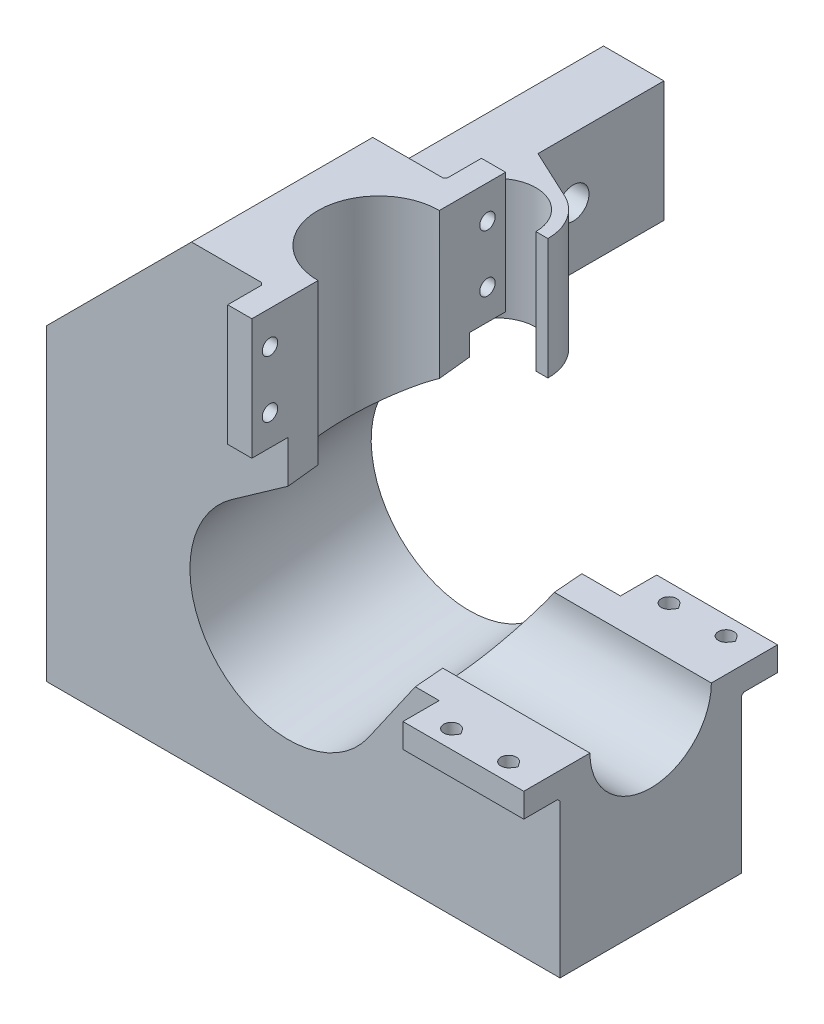
from build123d import *

# Parameters (mm, degrees)
BOSS_EXTRUDE1_DEPTH                       = 12.7
BOSS_EXTRUDE1_DEPTH_BACK                  = 12.7
CUT_EXTRUDE1_DEPTH                        = 83.589067678
CUT_EXTRUDE1_DEPTH_BACK                   = 83.589067678
SKETCH5_R                                 = 3.302
BOSS_EXTRUDE_START                        = -12.7
SKETCH10_W                                = 12.7
SKETCH10_H                                = 38.1
BOSS_EXTRUDE_ARM_FB_WIDTH_DEPTH           = 44.45
BOSS_EXTRUDE_ARM_CHASSIS_FB_DEPTH         = 95.25
SKETCH15_W                                = 55.88
SKETCH15_H                                = 38.1
BOSS_EXTRUDE_ARM_CHASSIS_LR_DEPTH         = 50.8
SKETCH16_R                                = 12.7635
CUT_EXTRUDE_CHASSIS_FB_DEPTH              = 128.199614864
SKETCH17_R                                = 12.7635
SKETCH17_W                                = 12.7635
SKETCH17_H                                = 38.1
CUT_EXTRUDE_CHASSIS_LR_DEPTH              = 128.199614864
CUT_EXTRUDE_START                         = -22.107857563
CUT_EXTRUDE_CHASSIS_JOINT_CLEARANCE_DEPTH = 43.685920391
SKETCH19_W                                = 25.4
SKETCH19_H                                = 5.08
BOSS_EXTRUDE_FB_CLAMP_TOP_DEPTH           = 7.62
BOSS_EXTRUDE_START_2                      = -38.1
SKETCH19_3_W                              = 25.4
SKETCH19_3_H                              = 5.08
BOSS_EXTRUDE_FB_CLAMP_BOTTOM_DEPTH        = 7.62
SKETCH20_W                                = 5.08
SKETCH20_H                                = 25.4
BOSS_EXTRUDE_LR_CLAMP_TOP_DEPTH           = 7.62
SKETCH20_3_W                              = 5.08
SKETCH20_3_H                              = 25.4
BOSS_EXTRUDE_LR_CLAMP_BOTTOM_DEPTH        = 7.62
CHAMFER1_SIZE                             = 0.508
CHAMFER2_SIZE                             = 30.48
CHAMFER7_SIZE                             = 5.08
SKETCH26_FB_CLAMP_HOLES_R                 = 1.625000052
CUT_EXTRUDE7_FB_HOLES_DEPTH               = 136.265877047
SKETCH23_LR_CLAMP_HOLES_R                 = 1.625000052
CUT_EXTRUDE8_FB_HOLES_DEPTH               = 114.46180152
CHAMFER8_SIZE                             = 0.508


# Read off the part's stored shape, not the designer's step: Cut-Extrude Chassis Joint Clearance
with BuildPart() as part:
    # Sketch3 → Boss-Extrude1 (new, two sides: drawn at the far end of the back side and taken through both)
    with BuildSketch(Plane(origin=(0, 0, 0), x_dir=(1, 0, 0), z_dir=(0, 1, 0)).offset(-BOSS_EXTRUDE1_DEPTH_BACK)):
        with BuildLine():
            Line((8.001, 0), (10.541, 0))
            ThreePointArc((10.541, 0), (8.89018923, 5.663675172), (4.454819097, 9.553390383))
            Line((4.454819097, 9.553390383), (-5.969, 14.414097055))
            Line((-5.969, 14.414097055), (-5.969, 40.894))
            Line((-5.969, 40.894), (-18.669, 40.894))
            Line((-18.669, 40.894), (-18.669, -76.2))
            Line((-18.669, -76.2), (-5.969, -76.2))
            Line((-5.969, -76.2), (-5.969, -5.327948949))
            ThreePointArc((-5.969, -5.327948949), (-2.851142929, 7.475759828), (8.001, 0))
        make_face()
    extrude(amount=BOSS_EXTRUDE1_DEPTH + BOSS_EXTRUDE1_DEPTH_BACK)

    # Sketch5 → Cut-Extrude1 (cut, two sides: drawn at the far end of the back side and taken through both)
    with BuildSketch(Plane.ZY.offset(18.669).offset(-CUT_EXTRUDE1_DEPTH_BACK)):
        with Locations((-21.844, 0)):
            Circle(SKETCH5_R)
        with Locations((21.844, 0)):
            Circle(SKETCH5_R)
    extrude(amount=CUT_EXTRUDE1_DEPTH + CUT_EXTRUDE1_DEPTH_BACK, mode=Mode.SUBTRACT)

    # Sketch10 → Boss-Extrude Arm FB Width (add)
    with BuildSketch(Plane.XZ.offset(12.7).offset(BOSS_EXTRUDE_START)):
        with Locations((-12.319, 57.15)):
            Rectangle(SKETCH10_W, SKETCH10_H)
    extrude(amount=BOSS_EXTRUDE_ARM_FB_WIDTH_DEPTH)

    # Sketch12 → Boss-Extrude Arm Chassis FB (add)
    with BuildSketch(Plane(origin=(-5.969, 0, 0), x_dir=(0, 0, -1), z_dir=(1, 0, 0))):
        Polygon((-38.1, 0), (-76.2, 0), (-76.2, -44.45), (-38.1, -44.45), (-38.1, -12.7), align=None)
    extrude(amount=BOSS_EXTRUDE_ARM_CHASSIS_FB_DEPTH)

    # Sketch15 → Boss-Extrude Arm Chassis LR (add)
    with BuildSketch(Plane(origin=(0, 0, 0), x_dir=(1, 0, 0), z_dir=(0, 1, 0))):
        with Locations((9.271, -57.15)):
            Rectangle(SKETCH15_W, SKETCH15_H)
    extrude(amount=BOSS_EXTRUDE_ARM_CHASSIS_LR_DEPTH)

    # Sketch16 → Cut-Extrude Chassis FB (cut, through all)
    with BuildSketch(Plane(origin=(32.122028853, -6.645348837, 57.15), x_dir=(0, 0, 1), z_dir=(-1, 0, 0))):
        Circle(SKETCH16_R)
        with BuildLine():
            Line((-19.05, 0), (-12.7635, 0))
            ThreePointArc((-12.7635, 0), (-9.025157412, 9.025157392), (-2.9e-08, 12.7635))
            Line((-2.9e-08, 12.7635), (-19.05, 12.7635))
            Line((-19.05, 12.7635), (-19.05, 0))
        make_face()
        with BuildLine():
            ThreePointArc((-2.9e-08, 12.7635), (9.025157392, 9.025157412), (12.7635, 0))
            Line((12.7635, 0), (19.05, 0))
            Line((19.05, 0), (19.05, 12.7635))
            Line((19.05, 12.7635), (-2.9e-08, 12.7635))
        make_face()
    extrude(amount=-CUT_EXTRUDE_CHASSIS_FB_DEPTH, mode=Mode.SUBTRACT)

    # Sketch17 → Cut-Extrude Chassis LR (cut, through all)
    with BuildSketch(Plane(origin=(32.122028853, -6.645348837, 57.15), x_dir=(1, 0, 0), z_dir=(0, 1, 0))):
        Circle(SKETCH17_R)
        with Locations((6.38175, 0)):
            Rectangle(SKETCH17_W, SKETCH17_H)
    extrude(amount=CUT_EXTRUDE_CHASSIS_LR_DEPTH, mode=Mode.SUBTRACT)

    # Cut-Extrude Chassis Joint Clearance outl → Cut-Extrude Chassis Joint Clearance (cut)
    with BuildSketch(Plane(origin=(0, 1.051977093, 58.045037899), x_dir=(1, 0, 0), z_dir=(0, -0.11550085817456393, 0.9933073803012538)).offset(CUT_EXTRUDE_START)):
        with BuildLine():
            Line((65.60424969, 4.087995405), (49.027279167, 4.087995405))
            ThreePointArc((49.027279167, 4.087995405), (41.651365859, 10.55649777), (32.122028853, 12.8883117))
            Line((32.122028853, 12.8883117), (32.122028853, 17.444547275))
            Line((32.122028853, 17.444547275), (20.284845148, 9.156062014))
            ThreePointArc((20.284845148, 9.156062014), (17.529112657, -22.342104497), (49.027279167, -19.586372005))
            Line((49.027279167, -19.586372005), (65.60424969, 4.087995405))
        make_face()
    extrude(amount=CUT_EXTRUDE_CHASSIS_JOINT_CLEARANCE_DEPTH, mode=Mode.SUBTRACT)

    # Sketch19 → Boss-Extrude FB Clamp Top (add)
    with BuildSketch(Plane.XY.offset(76.2)):
        with Locations((76.581, -9.185348837)):
            Rectangle(SKETCH19_W, SKETCH19_H)
    extrude(amount=BOSS_EXTRUDE_FB_CLAMP_TOP_DEPTH)

    # Sketch19<3> → Boss-Extrude FB Clamp Bottom (add)
    with BuildSketch(Plane.XY.offset(76.2).offset(BOSS_EXTRUDE_START_2)):
        with Locations((76.581, -9.185348837)):
            Rectangle(SKETCH19_3_W, SKETCH19_3_H)
    extrude(amount=-BOSS_EXTRUDE_FB_CLAMP_BOTTOM_DEPTH)

    # Sketch20 → Boss-Extrude LR Clamp Top (add)
    with BuildSketch(Plane.XY.offset(76.2)):
        with Locations((29.582028853, 38.1)):
            Rectangle(SKETCH20_W, SKETCH20_H)
    extrude(amount=BOSS_EXTRUDE_LR_CLAMP_TOP_DEPTH)

    # Sketch20<3> → Boss-Extrude LR Clamp Bottom (add)
    with BuildSketch(Plane.XY.offset(76.2).offset(BOSS_EXTRUDE_START_2)):
        with Locations((29.582028853, 38.1)):
            Rectangle(SKETCH20_3_W, SKETCH20_3_H)
    extrude(amount=-BOSS_EXTRUDE_LR_CLAMP_BOTTOM_DEPTH)

    # Chamfer1
    chamfer1_edges = [part.edges().sort_by_distance(p)[0] for p in [
        (76.581, -11.725348837, 76.2),
        (76.581, -11.725348837, 38.1),
    ]]
    chamfer(chamfer1_edges, length=CHAMFER1_SIZE)

    # Chamfer2
    chamfer2_edges = [part.edges().sort_by_distance(p)[0] for p in [
        (-18.669, 50.8, 57.15),
    ]]
    chamfer(chamfer2_edges, length=CHAMFER2_SIZE)

    # Chamfer7
    chamfer7_edges = [part.edges().sort_by_distance(p)[0] for p in [
        (-12.319, 12.7, 38.1),
        (-12.319, -12.7, 38.1),
    ]]
    chamfer(chamfer7_edges, length=CHAMFER7_SIZE)

    # Sketch26 FB Clamp Holes → Cut-Extrude7 FB Holes (cut, through all)
    with BuildSketch(Plane(origin=(0, -6.645348837, 0), x_dir=(1, 0, 0), z_dir=(0, 1, 0))):
        with Locations((70.281000154, -80.01)):
            Circle(SKETCH26_FB_CLAMP_HOLES_R)
        with BuildLine():
            Line((72.264758924, -80.01), (71.612122269, -79.077938261))
            ThreePointArc((71.612122269, -79.077938261), (71.830790249, -79.52135306), (71.906000206, -80.01))
            ThreePointArc((71.906000206, -80.01), (71.830790249, -80.49864694), (71.612122269, -80.942061739))
            Line((71.612122269, -80.942061739), (72.264758924, -80.01))
        make_face()
        with BuildLine():
            Line((84.2647588, -80.01), (83.612122145, -79.077938261))
            ThreePointArc((83.612122145, -79.077938261), (83.830790125, -79.52135306), (83.906000082, -80.01))
            ThreePointArc((83.906000082, -80.01), (83.830790125, -80.49864694), (83.612122145, -80.942061739))
            Line((83.612122145, -80.942061739), (84.2647588, -80.01))
        make_face()
        with Locations((82.28100003, -80.01)):
            Circle(SKETCH26_FB_CLAMP_HOLES_R)
        with BuildLine():
            Line((84.2647588, -34.29), (83.612122145, -33.357938261))
            ThreePointArc((83.612122145, -33.357938261), (83.830790125, -33.80135306), (83.906000082, -34.29))
            ThreePointArc((83.906000082, -34.29), (83.830790125, -34.77864694), (83.612122145, -35.222061739))
            Line((83.612122145, -35.222061739), (84.2647588, -34.29))
        make_face()
        with Locations((82.28100003, -34.29)):
            Circle(SKETCH26_FB_CLAMP_HOLES_R)
        with BuildLine():
            Line((72.264758924, -34.29), (71.612122269, -33.357938261))
            ThreePointArc((71.612122269, -33.357938261), (71.830790249, -33.80135306), (71.906000206, -34.29))
            ThreePointArc((71.906000206, -34.29), (71.830790249, -34.77864694), (71.612122269, -35.222061739))
            Line((71.612122269, -35.222061739), (72.264758924, -34.29))
        make_face()
        with Locations((70.281000154, -34.29)):
            Circle(SKETCH26_FB_CLAMP_HOLES_R)
    extrude(amount=-CUT_EXTRUDE7_FB_HOLES_DEPTH, mode=Mode.SUBTRACT)

    # Sketch23 LR Clamp Holes → Cut-Extrude8 FB Holes (cut, through all)
    with BuildSketch(Plane(origin=(32.122028853, 0, 0), x_dir=(0, 0, -1), z_dir=(1, 0, 0))):
        with Locations((-80.01, 43.80000003)):
            Circle(SKETCH23_LR_CLAMP_HOLES_R)
        with Locations((-80.01, 31.800000154)):
            Circle(SKETCH23_LR_CLAMP_HOLES_R)
        with Locations(Location((-34.29, 31.800000154, 0), (0, 0, 90))):
            Circle(SKETCH23_LR_CLAMP_HOLES_R)
        with Locations(Location((-34.29, 43.80000003, 0), (0, 0, 90))):
            Circle(SKETCH23_LR_CLAMP_HOLES_R)
    extrude(amount=-CUT_EXTRUDE8_FB_HOLES_DEPTH, mode=Mode.SUBTRACT)

    # Chamfer8
    chamfer8_edges = [part.edges().sort_by_distance(p)[0] for p in [
        (27.042028853, 38.1, 76.2),
        (27.042028853, 38.1, 38.1),
    ]]
    chamfer(chamfer8_edges, length=CHAMFER8_SIZE)


solid = part.part
